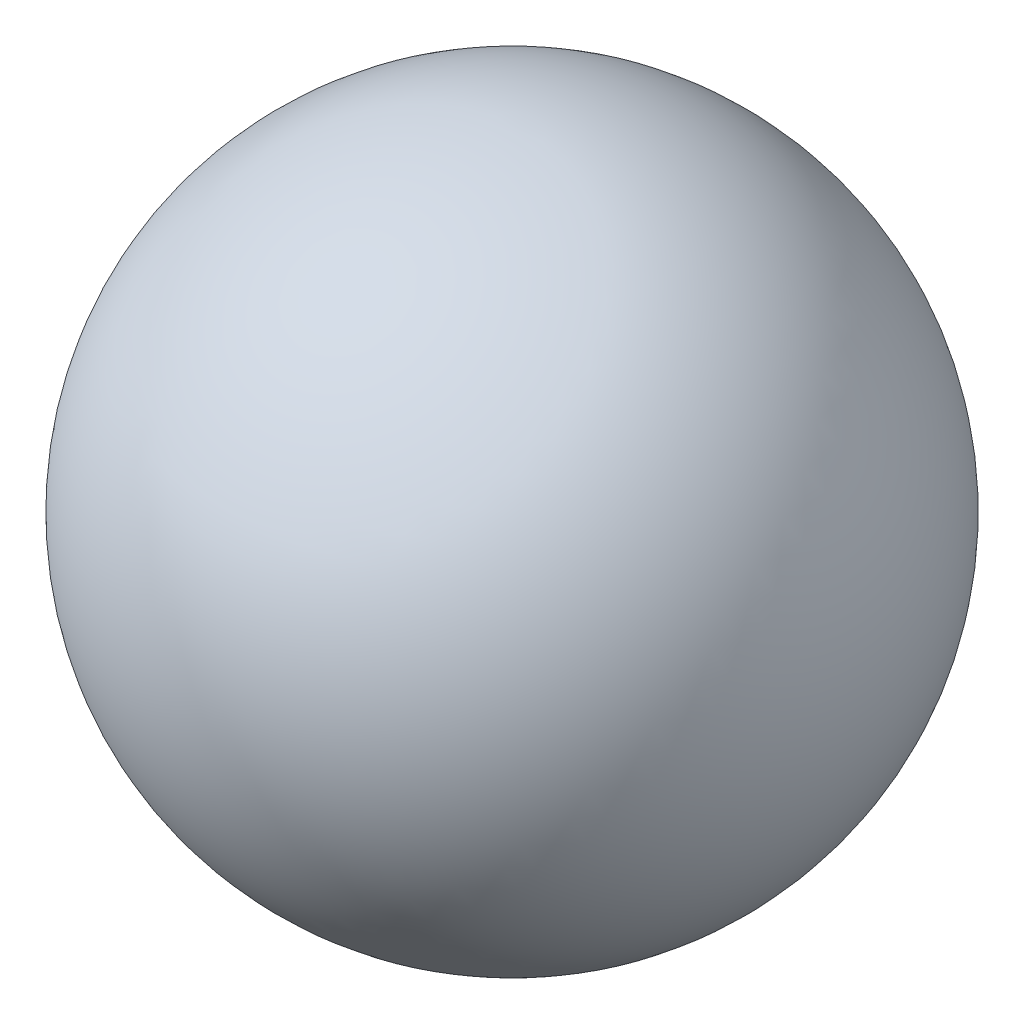
from build123d import *


with BuildPart() as part:
    # Sketch1 → Revolve1 (revolve)
    with BuildSketch(Plane.XY):
        with BuildLine():
            Line((0, 25), (0, -25))
            ThreePointArc((0, -25), (25, 0), (0, 25))
        make_face()
    revolve(axis=Axis((0, 25, 0), (0, -1, 0)))


solid = part.part
